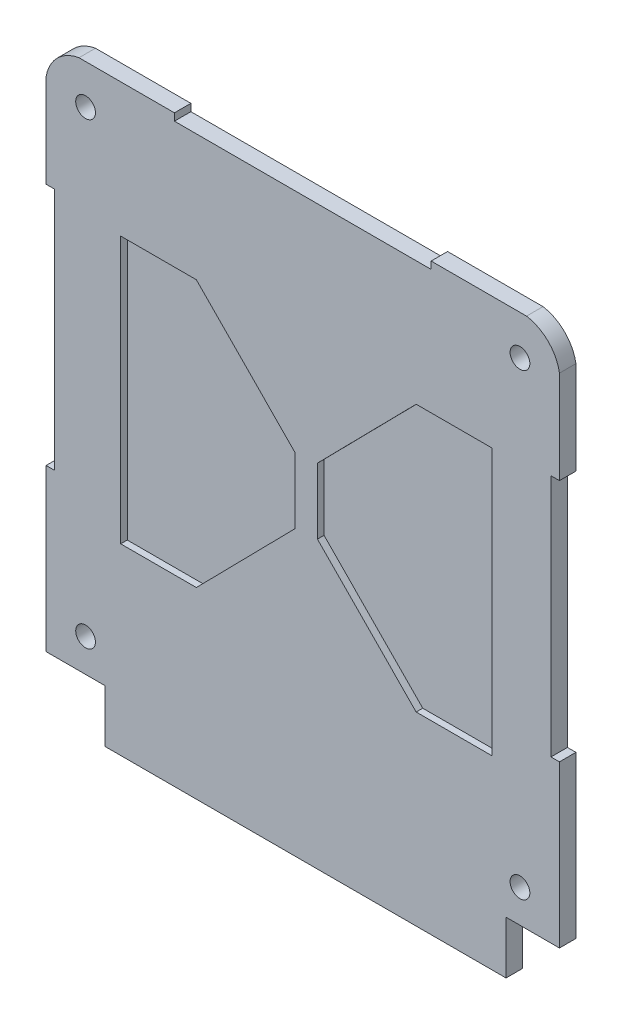
from build123d import *

# Parameters (mm, degrees)
BOSS_EXTRUDE1_DEPTH = 5
CUT_EXTRUDE1_DEPTH  = 2
SKETCH3_R           = 3
CUT_EXTRUDE2_DEPTH  = 42
SKETCH6_W           = 4
SKETCH6_H           = 4
SKETCH6_W_2         = 3.999984741
CUT_EXTRUDE4_DEPTH  = 3
CUT_EXTRUDE5_DEPTH  = 3
SKETCH8_W           = 121.9
SKETCH8_H           = 16
BOSS_EXTRUDE2_DEPTH = 5


with BuildPart() as part:
    # Sketch1 → Boss-Extrude1 (new body)
    with BuildSketch(Plane.XY):
        with BuildLine():
            Line((-75.420043945, 42.350021362), (-75.420043945, -31.650009155))
            Line((-75.420043945, -31.650009155), (-78, -31.650009155))
            Line((-78, -31.650009155), (-78, -80.650009155))
            Line((-78, -80.650009155), (78, -80.650009155))
            Line((78, -80.650009155), (78, -31.650009155))
            Line((78, -31.650009155), (75.419921875, -31.650009155))
            Line((75.419921875, -31.650009155), (75.419921875, 42.350021362))
            Line((75.419921875, 42.350021362), (78, 42.350021362))
            Line((78, 42.350021362), (78, 70.650009155))
            ThreePointArc((78, 70.650009155), (74.602310181, 77.252319336), (68, 80.650009155))
            Line((68, 80.650009155), (39, 80.650009155))
            Line((39, 80.650009155), (39, 78.449996948))
            Line((39, 78.449996948), (-39, 78.449996948))
            Line((-39, 78.449996948), (-39, 80.650009155))
            Line((-39, 80.650009155), (-68, 80.650009155))
            ThreePointArc((-68, 80.650009155), (-74.602340698, 77.252349854), (-78, 70.650009155))
            Line((-78, 70.650009155), (-78, 42.350021362))
            Line((-78, 42.350021362), (-75.420043945, 42.350021362))
        make_face()
    extrude(amount=BOSS_EXTRUDE1_DEPTH)

    # Sketch2 → Cut-Extrude1 (cut)
    with BuildSketch(Plane.XY.offset(5)):
        Polygon((-55.335259919, 40.055819665), (-55.335259919, -40.944180335), (-32.335259919, -40.944180335), (-2.335259919, -10.444180335), (-2.335259919, 9.555850183), (-32.335259919, 40.055819665), align=None)
        Polygon((4.458223483, 10.192739252), (4.458223483, -9.807291266), (34.458223483, -40.307291266), (57.458223483, -40.307291266), (57.458223483, 40.692708734), (34.458223483, 40.692708734), align=None)
    extrude(amount=-CUT_EXTRUDE1_DEPTH, mode=Mode.SUBTRACT)

    # Sketch3 → Cut-Extrude2 (cut)
    with BuildSketch(Plane.XY.offset(5)):
        with Locations((-66.000082844, 68.650091999)):
            Circle(SKETCH3_R)
        with Locations((65.999919006, 68.649928161)):
            Circle(SKETCH3_R)
        with Locations((-66.000082844, -70.650009155)):
            Circle(SKETCH3_R)
        with Locations((65.999919006, -70.650009155)):
            Circle(SKETCH3_R)
    extrude(amount=-CUT_EXTRUDE2_DEPTH, mode=Mode.SUBTRACT)

    # Sketch6 → Cut-Extrude4 (cut)
    with BuildSketch(Plane(origin=(0, 0, 0), x_dir=(-1, 0, 0), z_dir=(0, 0, -1))):
        with Locations((-61.995116115, -61.665595666)):
            Rectangle(SKETCH6_W, SKETCH6_H)
        with Locations((63.504872442, -61.665595666)):
            Rectangle(SKETCH6_W_2, SKETCH6_H)
    extrude(amount=-CUT_EXTRUDE4_DEPTH, mode=Mode.SUBTRACT)

    # Sketch7 → Cut-Extrude5 (cut)
    with BuildSketch(Plane(origin=(0, 0, 0), x_dir=(-1, 0, 0), z_dir=(0, 0, -1))):
        Polygon((-63.995116115, -59.665595666), (-63.995116115, 47.660531993), (65.504864812, 47.660531993), (65.504864812, -59.665595666), (61.504880071, -59.665595666), (61.504880071, 44.476086648), (-59.995116115, 44.476086648), (-59.995116115, -59.665595666), align=None)
    extrude(amount=-CUT_EXTRUDE5_DEPTH, mode=Mode.SUBTRACT)

    # Sketch8 → Boss-Extrude2 (add)
    with BuildSketch(Plane(origin=(0, 0, 0), x_dir=(-1, 0, 0), z_dir=(0, 0, -1))):
        with Locations((-0.820022175, -88.650009155)):
            Rectangle(SKETCH8_W, SKETCH8_H)
    extrude(amount=-BOSS_EXTRUDE2_DEPTH)


solid = part.part
